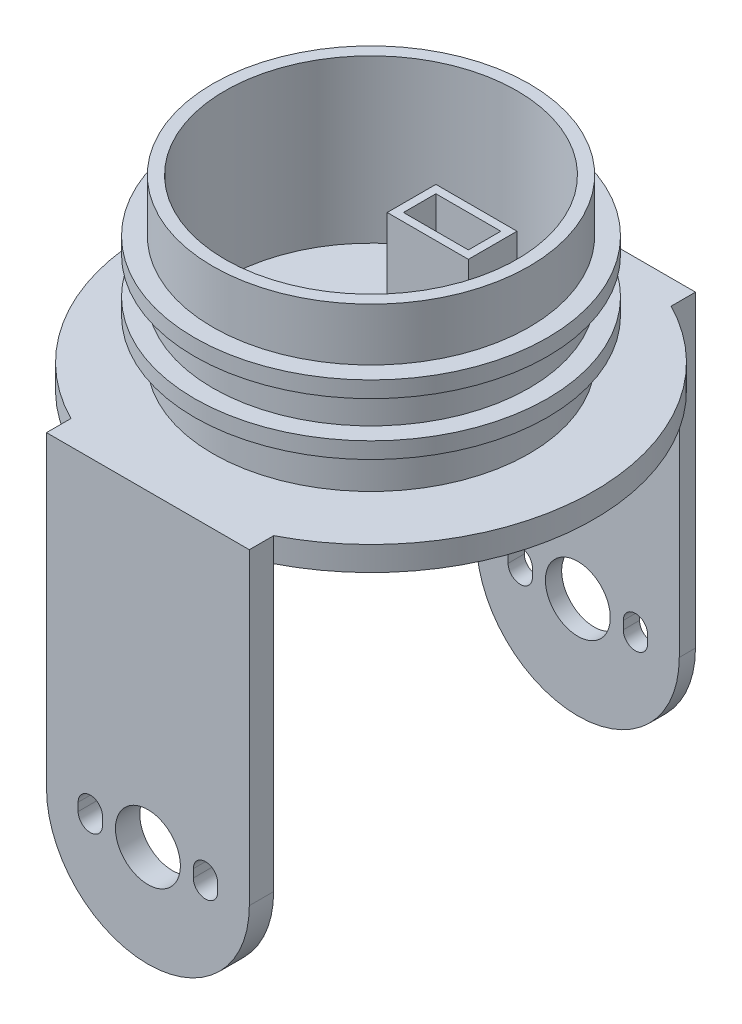
from build123d import *

# Parameters (mm, degrees)
SKETCH_1_R          = 19.5
SKETCH_1_R_2        = 18
EXTRUDE_1_DEPTH     = 20
SKETCH_3_R          = 27.5
EXTRUDE_2_DEPTH     = 3
EXTRUDE_START       = 2
SKETCH_25_R         = 21.75
SKETCH_25_R_2       = 19.5
EXTRUDE_12_DEPTH    = 2
EXTRUDE_START_2     = -1
SKETCH_26_R         = 21.75
SKETCH_26_R_2       = 19.5
EXTRUDE_13_DEPTH    = 2
SKETCH_27_W         = 25
SKETCH_27_H         = 51
EXTRUDE_14_DEPTH    = 3
SKETCH_28_R         = 4
EXTRUDE_17_DEPTH    = 2
EXTRUDE_START_3     = -53
SKETCH_28_15_R      = 4
EXTRUDE_19_DEPTH    = 53
SKETCH_32_W         = 2.204369859
SKETCH_32_H         = 3
EXTRUDE_20_DEPTH    = 2
CUT_EXTRUDE_START   = -50
SKETCH_28_18_R      = 4
CUT_EXTRUDE_8_DEPTH = 50
SKETCH_33_W         = 25
SKETCH_33_H         = 3
EXTRUDE_21_DEPTH    = 3
SKETCH_34_W         = 10
SKETCH_34_H         = 6
SKETCH_34_W_2       = 8
SKETCH_34_H_2       = 4
EXTRUDE_22_DEPTH    = 10
SKETCH_38_W         = 8
SKETCH_38_H         = 4
CUT_EXTRUDE_9_DEPTH = 3


with BuildPart() as part:
    # 草圖1 → 填料-伸長1 (new body)
    with BuildSketch(Plane(origin=(0, 0, 0), x_dir=(1, 0, 0), z_dir=(0, 1, 0))):
        Circle(SKETCH_1_R)
        Circle(SKETCH_1_R_2, mode=Mode.SUBTRACT)
    extrude(amount=EXTRUDE_1_DEPTH)

    # 草圖3 → 填料-伸長2 (add)
    with BuildSketch(Plane.XZ):
        Circle(SKETCH_3_R)
    extrude(amount=EXTRUDE_2_DEPTH)

    # 草圖25 → 填料-伸長12 (add)
    with BuildSketch(Plane(origin=(0, 7, 0), x_dir=(-1, 0, 0), z_dir=(0, -1, 0)).offset(EXTRUDE_START)):
        Circle(SKETCH_25_R)
        Circle(SKETCH_25_R_2, mode=Mode.SUBTRACT)
    extrude(amount=-EXTRUDE_12_DEPTH)

    # 草圖26 → 填料-伸長13 (add)
    with BuildSketch(Plane(origin=(0, 10.5, 0), x_dir=(-1, 0, 0), z_dir=(0, -1, 0)).offset(EXTRUDE_START_2)):
        Circle(SKETCH_26_R)
        Circle(SKETCH_26_R_2, mode=Mode.SUBTRACT)
    extrude(amount=-EXTRUDE_13_DEPTH)

    # 草圖27 → 填料-伸長14 (add)
    with BuildSketch(Plane.XZ.offset(3)):
        Rectangle(SKETCH_27_W, SKETCH_27_H)
    extrude(amount=-EXTRUDE_14_DEPTH)

    # 草圖28 → 填料-伸長17 (add)
    with BuildSketch(Plane(origin=(0, 0, -25.5), x_dir=(-1, 0, 0), z_dir=(0, 0, -1))):
        with BuildLine():
            Line((12.5, 0), (-12.5, 0))
            Line((-12.5, 0), (-12.5, -38))
            ThreePointArc((-12.5, -38), (0, -50.5), (12.5, -38))
            Line((12.5, -38), (12.5, 0))
        make_face()
        with BuildLine():
            Line((8.6, -37.5), (8.6, -38.5))
            ThreePointArc((8.6, -38.5), (7.1, -40), (5.6, -38.5))
            Line((5.6, -38.5), (5.6, -37.5))
            ThreePointArc((5.6, -37.5), (7.1, -36), (8.6, -37.5))
        make_face(mode=Mode.SUBTRACT)
        with Locations((0, -38)):
            Circle(SKETCH_28_R, mode=Mode.SUBTRACT)
        with BuildLine():
            Line((-5.6, -37.5), (-5.6, -38.5))
            ThreePointArc((-5.6, -38.5), (-7.1, -40), (-8.6, -38.5))
            Line((-8.6, -38.5), (-8.6, -37.5))
            ThreePointArc((-8.6, -37.5), (-7.1, -36), (-5.6, -37.5))
        make_face(mode=Mode.SUBTRACT)
    extrude(amount=EXTRUDE_17_DEPTH)

    # 草圖28<15> → 填料-伸長19 (add)
    with BuildSketch(Plane(origin=(0, 0, -25.5), x_dir=(-1, 0, 0), z_dir=(0, 0, -1)).offset(EXTRUDE_START_3)):
        with BuildLine():
            Line((12.5, -38), (12.5, -3))
            Line((12.5, -3), (-12.5, -3))
            Line((-12.5, -3), (-12.5, -38))
            ThreePointArc((-12.5, -38), (0, -50.5), (12.5, -38))
        make_face()
        with BuildLine():
            Line((8.6, -37.5), (8.6, -38.5))
            ThreePointArc((8.6, -38.5), (7.1, -40), (5.6, -38.5))
            Line((5.6, -38.5), (5.6, -37.5))
            ThreePointArc((5.6, -37.5), (7.1, -36), (8.6, -37.5))
        make_face(mode=Mode.SUBTRACT)
        with Locations((0, -38)):
            Circle(SKETCH_28_15_R, mode=Mode.SUBTRACT)
        with BuildLine():
            Line((-5.6, -37.5), (-5.6, -38.5))
            ThreePointArc((-5.6, -38.5), (-7.1, -40), (-8.6, -38.5))
            Line((-8.6, -38.5), (-8.6, -37.5))
            ThreePointArc((-8.6, -37.5), (-7.1, -36), (-5.6, -37.5))
        make_face(mode=Mode.SUBTRACT)
    extrude(amount=EXTRUDE_19_DEPTH)

    # 草圖32 → 填料-伸長20 (add)
    with BuildSketch(Plane.XY.offset(25.5)):
        with Locations((11.397815071, -1.5)):
            Rectangle(SKETCH_32_W, SKETCH_32_H)
        with Locations((-11.397815071, -1.5)):
            Rectangle(SKETCH_32_W, SKETCH_32_H)
    extrude(amount=EXTRUDE_20_DEPTH)

    # 草圖28<18> → 除料-伸長8 (cut)
    with BuildSketch(Plane(origin=(0, 0, -25.5), x_dir=(-1, 0, 0), z_dir=(0, 0, -1)).offset(CUT_EXTRUDE_START)):
        with BuildLine():
            Line((12.5, -38), (12.5, -3))
            Line((12.5, -3), (-12.5, -3))
            Line((-12.5, -3), (-12.5, -38))
            ThreePointArc((-12.5, -38), (0, -50.5), (12.5, -38))
        make_face()
        with BuildLine():
            Line((8.6, -37.5), (8.6, -38.5))
            ThreePointArc((8.6, -38.5), (7.1, -40), (5.6, -38.5))
            Line((5.6, -38.5), (5.6, -37.5))
            ThreePointArc((5.6, -37.5), (7.1, -36), (8.6, -37.5))
        make_face(mode=Mode.SUBTRACT)
        with Locations((0, -38)):
            Circle(SKETCH_28_18_R, mode=Mode.SUBTRACT)
        with BuildLine():
            Line((-5.6, -37.5), (-5.6, -38.5))
            ThreePointArc((-5.6, -38.5), (-7.1, -40), (-8.6, -38.5))
            Line((-8.6, -38.5), (-8.6, -37.5))
            ThreePointArc((-8.6, -37.5), (-7.1, -36), (-5.6, -37.5))
        make_face(mode=Mode.SUBTRACT)
    extrude(amount=CUT_EXTRUDE_8_DEPTH, mode=Mode.SUBTRACT)

    # 草圖33 → 填料-伸長21 (add)
    with BuildSketch(Plane.XY.offset(27.5)):
        with Locations((0, -1.5)):
            Rectangle(SKETCH_33_W, SKETCH_33_H)
    extrude(amount=-EXTRUDE_21_DEPTH)

    # 草圖34 → 填料-伸長22 (add)
    with BuildSketch(Plane(origin=(0, 0, 0), x_dir=(1, 0, 0), z_dir=(0, 1, 0))):
        with Locations((0, 10)):
            Rectangle(SKETCH_34_W, SKETCH_34_H)
        with Locations((0, 10)):
            Rectangle(SKETCH_34_W_2, SKETCH_34_H_2, mode=Mode.SUBTRACT)
    extrude(amount=EXTRUDE_22_DEPTH)

    # 草圖38 → 除料-伸長9 (cut)
    with BuildSketch(Plane(origin=(0, 0, 0), x_dir=(1, 0, 0), z_dir=(0, 1, 0))):
        with Locations((0, 10)):
            Rectangle(SKETCH_38_W, SKETCH_38_H)
    extrude(amount=-CUT_EXTRUDE_9_DEPTH, mode=Mode.SUBTRACT)


solid = part.part
